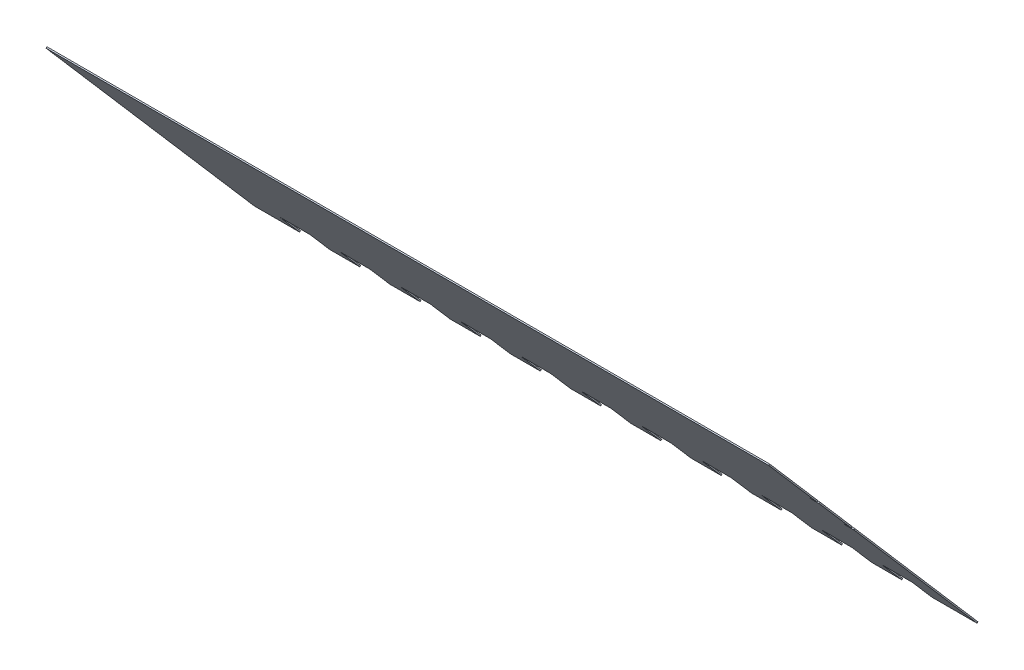
from build123d import *

# Parameters (mm, degrees)
BASE_FLANGE1_DEPTH = 600
SKETCH2_W          = 50
SKETCH2_H          = 50
CUT_EXTRUDE1_DEPTH = 10
CUT_EXTRUDE2_DEPTH = 13
FILLET1_R          = 0.74


# Sheet-metal steps are written as plain solids
with BuildPart() as part:
    # Sketch1 → Base-Flange1 (new, symmetric)
    with BuildSketch(Plane(origin=(0, 0, 0), x_dir=(0, 0, -1), z_dir=(1, 0, 0))):
        Polygon((0, 0), (346, -400), (344.487374796, -401.308420801), (-1.512625204, -1.308420801), align=None)
    extrude(amount=BASE_FLANGE1_DEPTH, both=True)

    # Sketch2 → Cut-Extrude1 (cut)
    with BuildSketch(Plane(origin=(0, 0, 0), x_dir=(-1, 0, 0), z_dir=(0, 0.6542104006098486, -0.7563126018610966))):
        with Locations((-500, -503.881839355)):
            Rectangle(SKETCH2_W, SKETCH2_H)
        with Locations((-400, -503.881839355)):
            Rectangle(SKETCH2_W, SKETCH2_H)
        with Locations((-300, -503.881839355)):
            Rectangle(SKETCH2_W, SKETCH2_H)
        with Locations((-200, -503.881839355)):
            Rectangle(SKETCH2_W, SKETCH2_H)
        with Locations((-100, -503.881839355)):
            Rectangle(SKETCH2_W, SKETCH2_H)
        with Locations((0, -503.881839355)):
            Rectangle(SKETCH2_W, SKETCH2_H)
        with Locations((100, -503.881839355)):
            Rectangle(SKETCH2_W, SKETCH2_H)
        with Locations((200, -503.881839355)):
            Rectangle(SKETCH2_W, SKETCH2_H)
        with Locations((300, -503.881839355)):
            Rectangle(SKETCH2_W, SKETCH2_H)
        with Locations((400, -503.881839355)):
            Rectangle(SKETCH2_W, SKETCH2_H)
        with Locations((500, -503.881839355)):
            Rectangle(SKETCH2_W, SKETCH2_H)
    extrude(amount=-CUT_EXTRUDE1_DEPTH, mode=Mode.SUBTRACT)

    # Sketch3 → Cut-Extrude2 (cut)
    with BuildSketch(Plane(origin=(600, 0, 0), x_dir=(0, 0, -1), z_dir=(1, 0, 0))):
        Polygon((136.934944411, -158.306294117), (135.422319207, -159.614714918), (140.001792012, -164.908903131), (141.514417215, -163.60048233), align=None)
        Polygon((80.905870334, -93.532798074), (83.542993835, -96.581495763), (82.030368632, -97.889916565), (79.39324513, -94.841218875), align=None)
    extrude(amount=-CUT_EXTRUDE2_DEPTH, mode=Mode.SUBTRACT)

    # Fillet1
    fillet1_edges = [part.edges().sort_by_distance(p)[0] for p in [
        (600, -164.254692731, -140.758104614),
        (600, -94.187008475, -80.149557732),
    ]]
    fillet(fillet1_edges, radius=FILLET1_R)


solid = part.part
